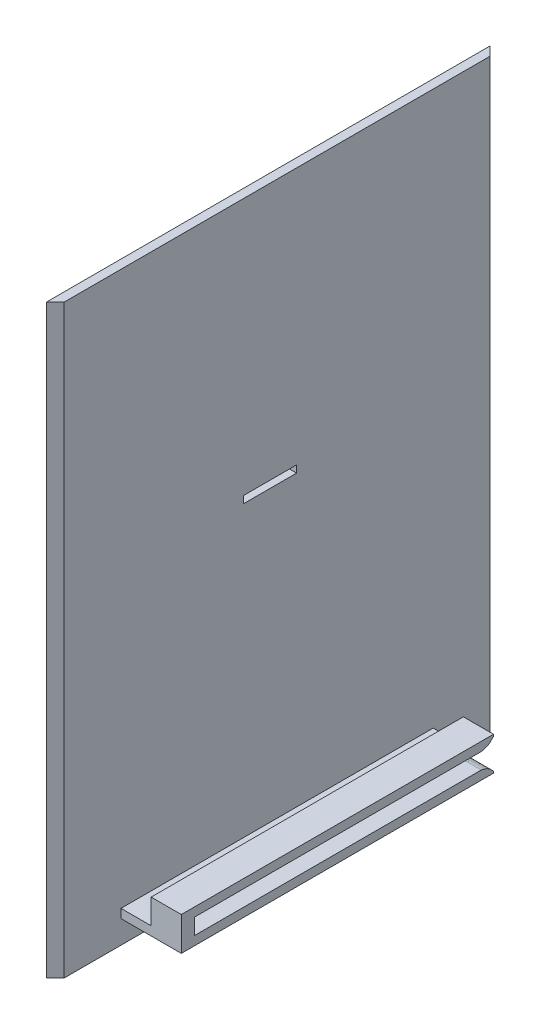
from build123d import *

# Parameters (mm, degrees)
CROQUIS1_W              = 5
CROQUIS1_H              = 250
SALIENTE_EXTRUIR1_DEPTH = 330
CORTAR_EXTRUIR1_REACH   = 416.035
CROQUIS3_W              = 176
CROQUIS3_H              = 5
SALIENTE_EXTRUIR2_DEPTH = 34
CROQUIS4_W              = 5
CROQUIS4_H              = 176
SALIENTE_EXTRUIR3_DEPTH = 9
CROQUIS5_W              = 17
CROQUIS5_H              = 176
SALIENTE_EXTRUIR4_DEPTH = 5
REDONDEO1_SIZE          = 4
CROQUIS6_W              = 12
CROQUIS6_H              = 7.334173777
SALIENTE_EXTRUIR5_DEPTH = 9
CORTAR_EXTRUIR2_REACH   = 417.838
CROQUIS7_W              = 30
CROQUIS7_H              = 4


with BuildPart() as part:
    # Croquis1 → Saliente-Extruir1 (new body)
    with BuildSketch(Plane(origin=(0, 0, 0), x_dir=(1, 0, 0), z_dir=(0, 1, 0))):
        with Locations((-2.5, 125)):
            Rectangle(CROQUIS1_W, CROQUIS1_H)
    extrude(amount=SALIENTE_EXTRUIR1_DEPTH)

    # Croquis2 → Cortar-Extruir1 (cut, up to next)
    with BuildSketch(Plane(origin=(0, 330, 0), x_dir=(1, 0, 0), z_dir=(0, 1, 0)), mode=Mode.PRIVATE) as cortar_extruir1_sk1:
        Polygon((0, 250), (0, 245), (-5, 250), align=None)
    cortar_extruir1_tool1 = extrude(cortar_extruir1_sk1.sketch, amount=-CORTAR_EXTRUIR1_REACH, mode=Mode.PRIVATE) & part.part
    # Croquis2 → Cortar-Extruir1 (cut, up to next)
    with BuildSketch(Plane(origin=(0, 330, 0), x_dir=(1, 0, 0), z_dir=(0, 1, 0)), mode=Mode.PRIVATE) as cortar_extruir1_sk2:
        Polygon((-5, 0), (0, 5), (0, 0), align=None)
    cortar_extruir1_tool2 = extrude(cortar_extruir1_sk2.sketch, amount=-CORTAR_EXTRUIR1_REACH, mode=Mode.PRIVATE) & part.part
    add(cortar_extruir1_tool1.solids().sort_by_distance((-1.666667, 330, -248.333333))[0], mode=Mode.SUBTRACT)
    add(cortar_extruir1_tool2.solids().sort_by_distance((-1.666667, 330, -1.666667))[0], mode=Mode.SUBTRACT)

    # Croquis3 → Saliente-Extruir2 (add)
    with BuildSketch(Plane(origin=(0, 0, 0), x_dir=(0, 0, -1), z_dir=(1, 0, 0))):
        with Locations((125, 15.5)):
            Rectangle(CROQUIS3_W, CROQUIS3_H)
    extrude(amount=SALIENTE_EXTRUIR2_DEPTH)

    # Croquis4 → Saliente-Extruir3 (add)
    with BuildSketch(Plane(origin=(0, 18, 0), x_dir=(1, 0, 0), z_dir=(0, 1, 0))):
        with Locations((19.5, 125)):
            Rectangle(CROQUIS4_W, CROQUIS4_H)
    extrude(amount=SALIENTE_EXTRUIR3_DEPTH)

    # Croquis5 → Saliente-Extruir4 (add)
    with BuildSketch(Plane(origin=(0, 27, 0), x_dir=(1, 0, 0), z_dir=(0, 1, 0))):
        with Locations((25.5, 125)):
            Rectangle(CROQUIS5_W, CROQUIS5_H)
    extrude(amount=SALIENTE_EXTRUIR4_DEPTH)

    # Redondeo1
    redondeo1_edges = [part.edges().sort_by_distance(p)[0] for p in [
        (28, 18, -213),
        (22, 22.5, -213),
        (28, 27, -213),
    ]]
    chamfer(redondeo1_edges, length=REDONDEO1_SIZE)

    # Redondeo2
    # a fillet whose section is not a circle: 7 mm, written as the material it takes off along each edge
    with BuildSketch(Plane(origin=(22, 27, -209), x_dir=(0, 0.7071067811865493, -0.7071067811865457), z_dir=(1, 0, 0))) as redondeo2_piece_1_section:
        with BuildLine():
            Bezier((2.899494937, 0), (0, 0), (-2.050252532, 2.050252532), weights=[1, 0.428571429, 1])
            Line((-2.050252532, 2.050252532), (0, 0))
            Line((0, 0), (2.899494937, 0))
        make_face()
    redondeo2_piece_1 = extrude(amount=19.248737342, mode=Mode.PRIVATE)
    redondeo2_piece_1 = split(redondeo2_piece_1, bisect_by=Plane(origin=(22, 27, -209), z_dir=(-0.7071067811865476, 0, 0.7071067811865476)), keep=Keep.TOP, mode=Mode.PRIVATE)
    add(redondeo2_piece_1, mode=Mode.SUBTRACT)
    with BuildSketch(Plane(origin=(14.751262658, 27, -209), x_dir=(0, 0.7071067811865493, -0.7071067811865457), z_dir=(1, 0, 0))) as redondeo2_piece_2_section:
        with BuildLine():
            Bezier((2.899494937, 0), (0, 0), (-2.050252532, 2.050252532), weights=[1, 0.428571429, 1])
            Line((-2.050252532, 2.050252532), (0, 0))
            Line((0, 0), (2.899494937, 0))
        make_face()
    redondeo2_piece_2 = extrude(amount=26.497474683, mode=Mode.PRIVATE)
    redondeo2_piece_2 = split(redondeo2_piece_2, bisect_by=Plane(origin=(18.375631329, 27, -212.624368671), z_dir=(0.7071067811865476, 0, -0.7071067811865476)), keep=Keep.TOP, mode=Mode.PRIVATE)
    redondeo2_piece_2 = split(redondeo2_piece_2, bisect_by=Plane(origin=(22, 27, -209), z_dir=(-1, 0, 0)), keep=Keep.TOP, mode=Mode.PRIVATE)
    add(redondeo2_piece_2, mode=Mode.SUBTRACT)
    with BuildSketch(Plane(origin=(22, 27, -209), x_dir=(0, 0.7071067811865493, -0.7071067811865457), z_dir=(1, 0, 0))) as redondeo2_piece_3_section:
        with BuildLine():
            Bezier((2.899494937, 0), (0, 0), (-2.050252532, 2.050252532), weights=[1, 0.428571429, 1])
            Line((-2.050252532, 2.050252532), (0, 0))
            Line((0, 0), (2.899494937, 0))
        make_face()
    redondeo2_piece_3 = extrude(amount=19.248737342, mode=Mode.PRIVATE)
    redondeo2_piece_3 = split(redondeo2_piece_3, bisect_by=Plane(origin=(22, 27, -209), z_dir=(0.7071067811865476, 0, -0.7071067811865476)), keep=Keep.TOP, mode=Mode.PRIVATE)
    add(redondeo2_piece_3, mode=Mode.SUBTRACT)
    with BuildSketch(Plane(origin=(22, 18, -209), x_dir=(-0.7071067811865493, 0, -0.7071067811865457), z_dir=(0, 1, 0))) as redondeo2_piece_4_section:
        with BuildLine():
            Bezier((2.899494937, 0), (0, 0), (-2.050252532, 2.050252532), weights=[1, 0.428571429, 1])
            Line((-2.050252532, 2.050252532), (0, 0))
            Line((0, 0), (2.899494937, 0))
        make_face()
    redondeo2_piece_4 = extrude(amount=9, mode=Mode.PRIVATE)
    redondeo2_piece_4 = split(redondeo2_piece_4, bisect_by=Plane(origin=(22, 18, -209), z_dir=(0, -0.7071067811865476, 0.7071067811865476)), keep=Keep.TOP, mode=Mode.PRIVATE)
    add(redondeo2_piece_4, mode=Mode.SUBTRACT)
    with BuildSketch(Plane(origin=(22, 10.751262658, -209), x_dir=(-0.7071067811865493, 0, -0.7071067811865457), z_dir=(0, 1, 0))) as redondeo2_piece_5_section:
        with BuildLine():
            Bezier((2.899494937, 0), (0, 0), (-2.050252532, 2.050252532), weights=[1, 0.428571429, 1])
            Line((-2.050252532, 2.050252532), (0, 0))
            Line((0, 0), (2.899494937, 0))
        make_face()
    redondeo2_piece_5 = extrude(amount=16.248737342, mode=Mode.PRIVATE)
    redondeo2_piece_5 = split(redondeo2_piece_5, bisect_by=Plane(origin=(22, 14.375631329, -212.624368671), z_dir=(0, 0.7071067811865476, -0.7071067811865476)), keep=Keep.TOP, mode=Mode.PRIVATE)
    redondeo2_piece_5 = split(redondeo2_piece_5, bisect_by=Plane(origin=(22, 18, -209), z_dir=(0, -1, 0)), keep=Keep.TOP, mode=Mode.PRIVATE)
    add(redondeo2_piece_5, mode=Mode.SUBTRACT)
    with BuildSketch(Plane(origin=(22, 18, -209), x_dir=(-0.7071067811865493, 0, -0.7071067811865457), z_dir=(0, 1, 0))) as redondeo2_piece_6_section:
        with BuildLine():
            Bezier((2.899494937, 0), (0, 0), (-2.050252532, 2.050252532), weights=[1, 0.428571429, 1])
            Line((-2.050252532, 2.050252532), (0, 0))
            Line((0, 0), (2.899494937, 0))
        make_face()
    redondeo2_piece_6 = extrude(amount=9, mode=Mode.PRIVATE)
    redondeo2_piece_6 = split(redondeo2_piece_6, bisect_by=Plane(origin=(22, 18, -209), z_dir=(0, 0.7071067811865476, -0.7071067811865476)), keep=Keep.TOP, mode=Mode.PRIVATE)
    redondeo2_piece_6 = split(redondeo2_piece_6, bisect_by=Plane(origin=(22, 22.5, -204.5), z_dir=(0, -0.7071067811865476, -0.7071067811865476)), keep=Keep.TOP, mode=Mode.PRIVATE)
    add(redondeo2_piece_6, mode=Mode.SUBTRACT)
    with BuildSketch(Plane(origin=(22, 18, -209), x_dir=(-0.7071067811865493, 0, -0.7071067811865457), z_dir=(0, 1, 0))) as redondeo2_piece_7_section:
        with BuildLine():
            Bezier((2.899494937, 0), (0, 0), (-2.050252532, 2.050252532), weights=[1, 0.428571429, 1])
            Line((-2.050252532, 2.050252532), (0, 0))
            Line((0, 0), (2.899494937, 0))
        make_face()
    redondeo2_piece_7 = extrude(amount=9, mode=Mode.PRIVATE)
    redondeo2_piece_7 = split(redondeo2_piece_7, bisect_by=Plane(origin=(22, 22.5, -204.5), z_dir=(0, 0.7071067811865476, 0.7071067811865476)), keep=Keep.TOP, mode=Mode.PRIVATE)
    add(redondeo2_piece_7, mode=Mode.SUBTRACT)
    with BuildSketch(Plane(origin=(22, 18, -209), x_dir=(-0.7071067811865493, 0, -0.7071067811865457), z_dir=(0, 1, 0))) as redondeo2_piece_8_section:
        with BuildLine():
            Bezier((2.899494937, 0), (0, 0), (-2.050252532, 2.050252532), weights=[1, 0.428571429, 1])
            Line((-2.050252532, 2.050252532), (0, 0))
            Line((0, 0), (2.899494937, 0))
        make_face()
    redondeo2_piece_8 = extrude(amount=16.248737342, mode=Mode.PRIVATE)
    redondeo2_piece_8 = split(redondeo2_piece_8, bisect_by=Plane(origin=(22, 22.5, -204.5), z_dir=(0, -0.7071067811865476, -0.7071067811865476)), keep=Keep.TOP, mode=Mode.PRIVATE)
    redondeo2_piece_8 = split(redondeo2_piece_8, bisect_by=Plane(origin=(22, 27, -209), z_dir=(0, 1, 0)), keep=Keep.TOP, mode=Mode.PRIVATE)
    add(redondeo2_piece_8, mode=Mode.SUBTRACT)
    with BuildSketch(Plane(origin=(22, 18, -209), x_dir=(0, -0.7071067811865497, -0.7071067811865454), z_dir=(1, 0, 0))) as redondeo2_piece_9_section:
        with BuildLine():
            Bezier((2.899494937, 0), (0, 0), (-2.050252532, -2.050252532), weights=[1, 0.428571429, 1])
            Line((-2.050252532, -2.050252532), (0, 0))
            Line((0, 0), (2.899494937, 0))
        make_face()
    redondeo2_piece_9 = extrude(amount=19.248737342, mode=Mode.PRIVATE)
    redondeo2_piece_9 = split(redondeo2_piece_9, bisect_by=Plane(origin=(22, 18, -209), z_dir=(-0.7071067811865476, 0, 0.7071067811865476)), keep=Keep.TOP, mode=Mode.PRIVATE)
    add(redondeo2_piece_9, mode=Mode.SUBTRACT)
    with BuildSketch(Plane(origin=(14.751262658, 18, -209), x_dir=(0, -0.7071067811865497, -0.7071067811865454), z_dir=(1, 0, 0))) as redondeo2_piece_10_section:
        with BuildLine():
            Bezier((2.899494937, 0), (0, 0), (-2.050252532, -2.050252532), weights=[1, 0.428571429, 1])
            Line((-2.050252532, -2.050252532), (0, 0))
            Line((0, 0), (2.899494937, 0))
        make_face()
    redondeo2_piece_10 = extrude(amount=26.497474683, mode=Mode.PRIVATE)
    redondeo2_piece_10 = split(redondeo2_piece_10, bisect_by=Plane(origin=(18.375631329, 18, -212.624368671), z_dir=(0.7071067811865476, 0, -0.7071067811865476)), keep=Keep.TOP, mode=Mode.PRIVATE)
    redondeo2_piece_10 = split(redondeo2_piece_10, bisect_by=Plane(origin=(22, 18, -209), z_dir=(-1, 0, 0)), keep=Keep.TOP, mode=Mode.PRIVATE)
    add(redondeo2_piece_10, mode=Mode.SUBTRACT)
    with BuildSketch(Plane(origin=(22, 18, -209), x_dir=(0, -0.7071067811865497, -0.7071067811865454), z_dir=(1, 0, 0))) as redondeo2_piece_11_section:
        with BuildLine():
            Bezier((2.899494937, 0), (0, 0), (-2.050252532, -2.050252532), weights=[1, 0.428571429, 1])
            Line((-2.050252532, -2.050252532), (0, 0))
            Line((0, 0), (2.899494937, 0))
        make_face()
    redondeo2_piece_11 = extrude(amount=19.248737342, mode=Mode.PRIVATE)
    redondeo2_piece_11 = split(redondeo2_piece_11, bisect_by=Plane(origin=(22, 18, -209), z_dir=(0.7071067811865476, 0, -0.7071067811865476)), keep=Keep.TOP, mode=Mode.PRIVATE)
    add(redondeo2_piece_11, mode=Mode.SUBTRACT)
    with BuildSketch(Plane(origin=(22, 18, -209), x_dir=(-0.7071067811865493, 0, -0.7071067811865457), z_dir=(0, 1, 0))) as redondeo2_piece_12a_section:
        with BuildLine():
            Bezier((2.899494937, 0), (0, 0), (-2.050252532, 2.050252532), weights=[1, 0.428571429, 1])
            Line((-2.050252532, 2.050252532), (0, 0))
            Line((0, 0), (2.899494937, 0))
        make_face()
    redondeo2_piece_12a = extrude(amount=16.248737342, mode=Mode.PRIVATE)
    redondeo2_piece_12a = split(redondeo2_piece_12a, bisect_by=Plane(origin=(22, 22.5, -204.5), z_dir=(0, 0.7071067811865476, 0.7071067811865476)), keep=Keep.TOP, mode=Mode.PRIVATE)
    redondeo2_piece_12a = split(redondeo2_piece_12a, bisect_by=Plane(origin=(22, 27, -209), z_dir=(0, 1, 0)), keep=Keep.TOP, mode=Mode.PRIVATE)
    with BuildSketch(Plane(origin=(14.751262658, 27, -209), x_dir=(0, 0.7071067811865493, -0.7071067811865457), z_dir=(1, 0, 0))) as redondeo2_piece_12b_section:
        with BuildLine():
            Bezier((2.899494937, 0), (0, 0), (-2.050252532, 2.050252532), weights=[1, 0.428571429, 1])
            Line((-2.050252532, 2.050252532), (0, 0))
            Line((0, 0), (2.899494937, 0))
        make_face()
    redondeo2_piece_12b = extrude(amount=26.497474683, mode=Mode.PRIVATE)
    redondeo2_piece_12b = split(redondeo2_piece_12b, bisect_by=Plane(origin=(18.375631329, 27, -212.624368671), z_dir=(-0.7071067811865476, 0, 0.7071067811865476)), keep=Keep.TOP, mode=Mode.PRIVATE)
    redondeo2_piece_12b = split(redondeo2_piece_12b, bisect_by=Plane(origin=(22, 27, -209), z_dir=(-1, 0, 0)), keep=Keep.TOP, mode=Mode.PRIVATE)
    redondeo2_piece_12 = redondeo2_piece_12a & redondeo2_piece_12b
    add(redondeo2_piece_12, mode=Mode.SUBTRACT)
    with BuildSketch(Plane(origin=(14.751262658, 18, -209), x_dir=(0, -0.7071067811865497, -0.7071067811865454), z_dir=(1, 0, 0))) as redondeo2_piece_13a_section:
        with BuildLine():
            Bezier((2.899494937, 0), (0, 0), (-2.050252532, -2.050252532), weights=[1, 0.428571429, 1])
            Line((-2.050252532, -2.050252532), (0, 0))
            Line((0, 0), (2.899494937, 0))
        make_face()
    redondeo2_piece_13a = extrude(amount=26.497474683, mode=Mode.PRIVATE)
    redondeo2_piece_13a = split(redondeo2_piece_13a, bisect_by=Plane(origin=(18.375631329, 18, -212.624368671), z_dir=(-0.7071067811865476, 0, 0.7071067811865476)), keep=Keep.TOP, mode=Mode.PRIVATE)
    redondeo2_piece_13a = split(redondeo2_piece_13a, bisect_by=Plane(origin=(22, 18, -209), z_dir=(-1, 0, 0)), keep=Keep.TOP, mode=Mode.PRIVATE)
    redondeo2_piece_13a = split(redondeo2_piece_13a, bisect_by=Plane(origin=(17, 18, -209), z_dir=(1, 0, 0)), keep=Keep.TOP, mode=Mode.PRIVATE)
    with BuildSketch(Plane(origin=(22, 10.751262658, -209), x_dir=(-0.7071067811865493, 0, -0.7071067811865457), z_dir=(0, 1, 0))) as redondeo2_piece_13b_section:
        with BuildLine():
            Bezier((2.899494937, 0), (0, 0), (-2.050252532, 2.050252532), weights=[1, 0.428571429, 1])
            Line((-2.050252532, 2.050252532), (0, 0))
            Line((0, 0), (2.899494937, 0))
        make_face()
    redondeo2_piece_13b = extrude(amount=16.248737342, mode=Mode.PRIVATE)
    redondeo2_piece_13b = split(redondeo2_piece_13b, bisect_by=Plane(origin=(22, 14.375631329, -212.624368671), z_dir=(0, -0.7071067811865476, 0.7071067811865476)), keep=Keep.TOP, mode=Mode.PRIVATE)
    redondeo2_piece_13b = split(redondeo2_piece_13b, bisect_by=Plane(origin=(22, 18, -209), z_dir=(0, -1, 0)), keep=Keep.TOP, mode=Mode.PRIVATE)
    redondeo2_piece_13 = redondeo2_piece_13a & redondeo2_piece_13b
    add(redondeo2_piece_13, mode=Mode.SUBTRACT)

    # Croquis6 → Saliente-Extruir5 (add)
    with BuildSketch(Plane(origin=(0, 18, 0), x_dir=(1, 0, 0), z_dir=(0, 1, 0))):
        with Locations((28, 40.667086889)):
            Rectangle(CROQUIS6_W, CROQUIS6_H)
    extrude(amount=SALIENTE_EXTRUIR5_DEPTH)

    # Croquis7 → Cortar-Extruir2 (cut, up to next)
    with BuildSketch(Plane.ZY.offset(5), mode=Mode.PRIVATE) as cortar_extruir2_sk1:
        with Locations((-121, 183)):
            Rectangle(CROQUIS7_W, CROQUIS7_H)
    cortar_extruir2_tool1 = extrude(cortar_extruir2_sk1.sketch, amount=-CORTAR_EXTRUIR2_REACH, mode=Mode.PRIVATE) & part.part
    add(cortar_extruir2_tool1.solids().sort_by_distance((-5, 183, -121))[0], mode=Mode.SUBTRACT)


solid = part.part
